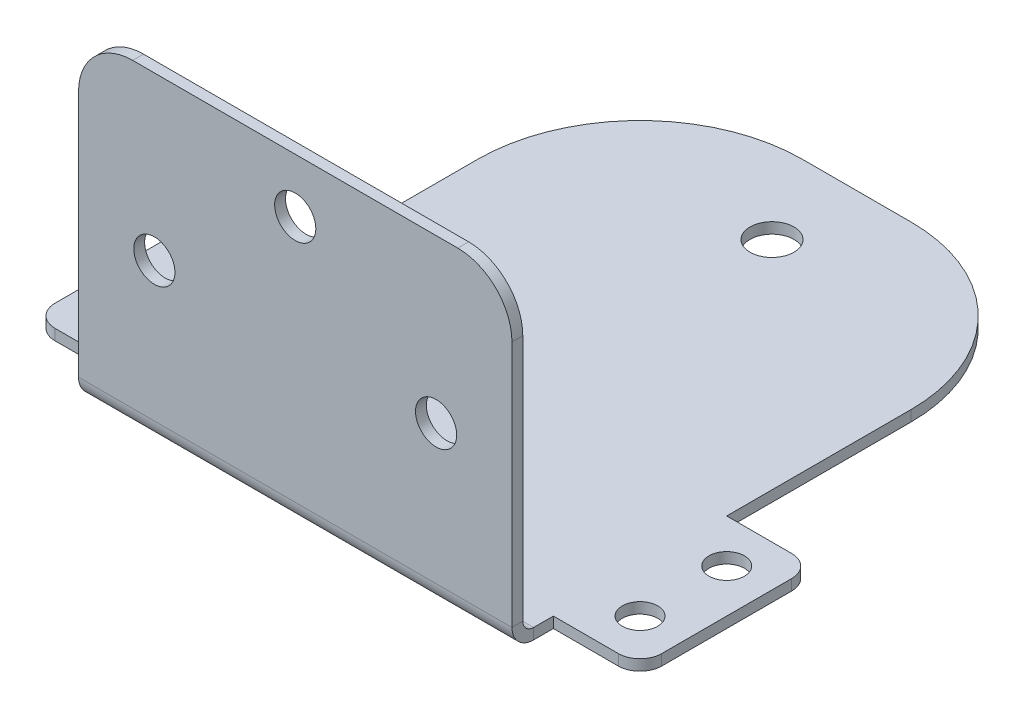
from build123d import *

# Parameters (mm, degrees)
BASE_FLANGE1_DEPTH       = 1
SKETCHED_START           = 11.616422755
SKETCHED_BEND1_OUTLINE_W = 40
SKETCHED_BEND1_OUTLINE_H = 1
SKETCHED_BEND1_DEPTH     = 28.383577245
SKETCHED_START_2         = 10.821902755
SKETCHED_BEND1_2_DEPTH   = 0.00548
SKETCHED_START_3         = 9.821902755
SKETCHED_BEND1_3_DEPTH   = 2
SKETCHED_START_4         = -20
SKETCHED_BEND1_4_DEPTH   = 40
SKETCH7_R                = 2.025
CUT_EXTRUDE1_DEPTH       = 10
F_6_CLEARANCE_HOLE1_D    = 3.7973
F_4_CLEARANCE_HOLE2_D    = 3.2639


with BuildPart() as part:
    # Base-Flange1: sheet metal written as solids
    # Sketch1 → Base-Flange1 (new body)
    with BuildSketch(Plane(origin=(0, 0, 0), x_dir=(1, 0, 0), z_dir=(0, 1, 0))):
        with BuildLine():
            Line((-20, -8), (-20, -35))
            ThreePointArc((-20, -35), (-18.535533906, -38.535533906), (-15, -40))
            Line((-15, -40), (15, -40))
            ThreePointArc((15, -40), (18.535533906, -38.535533906), (20, -35))
            Line((20, -35), (20, -8))
            Line((20, -8), (26, -8))
            ThreePointArc((26, -8), (27.414213562, -7.414213562), (28, -6))
            Line((28, -6), (28, 6))
            ThreePointArc((28, 6), (27.414213562, 7.414213562), (26, 8))
            Line((26, 8), (20, 8))
            Line((20, 8), (20, 25))
            ThreePointArc((20, 25), (15.606601718, 35.606601718), (5, 40))
            Line((5, 40), (-5, 40))
            ThreePointArc((-5, 40), (-15.606601718, 35.606601718), (-20, 25))
            Line((-20, 25), (-20, 8))
            Line((-20, 8), (-26, 8))
            ThreePointArc((-26, 8), (-27.414213562, 7.414213562), (-28, 6))
            Line((-28, 6), (-28, -6))
            ThreePointArc((-28, -6), (-27.414213562, -7.414213562), (-26, -8))
            Line((-26, -8), (-20, -8))
        make_face()
    extrude(amount=-BASE_FLANGE1_DEPTH)

    # Sketched Bend1: read off the stored shape, not the designer's step
    # Sketched Bend1 outline → Sketched Bend1 (cut)
    with BuildSketch(Plane.XY.offset(SKETCHED_START)):
        with Locations((0, -0.5)):
            Rectangle(SKETCHED_BEND1_OUTLINE_W, SKETCHED_BEND1_OUTLINE_H)
    extrude(amount=SKETCHED_BEND1_DEPTH, mode=Mode.SUBTRACT)

    # Sketched Bend1 2 outline → Sketched Bend1 2 (add)
    with BuildSketch(Plane.XY.offset(SKETCHED_START_2)):
        with BuildLine():
            Line((20, 0), (20, 23.821902755))
            ThreePointArc((20, 23.821902755), (18.535533906, 27.357436661), (15, 28.821902755))
            Line((15, 28.821902755), (-15, 28.821902755))
            ThreePointArc((-15, 28.821902755), (-18.535533906, 27.357436661), (-20, 23.821902755))
            Line((-20, 23.821902755), (-20, 0))
            Line((-20, 0), (20, 0))
        make_face()
    extrude(amount=SKETCHED_BEND1_2_DEPTH)

    # Sketched Bend1 3 outline → Sketched Bend1 3 (add)
    with BuildSketch(Plane.XY.offset(SKETCHED_START_3)):
        with BuildLine():
            Line((20, 0), (20, 23.821902755))
            ThreePointArc((20, 23.821902755), (18.535533906, 27.357436661), (15, 28.821902755))
            Line((15, 28.821902755), (-15, 28.821902755))
            ThreePointArc((-15, 28.821902755), (-18.535533906, 27.357436661), (-20, 23.821902755))
            Line((-20, 23.821902755), (-20, 0))
            Line((-20, 0), (20, 0))
        make_face()
    extrude(amount=SKETCHED_BEND1_3_DEPTH)

    # Sketched Bend1 4 outline → Sketched Bend1 4 (cut)
    with BuildSketch(Plane.YZ.offset(SKETCHED_START_4)):
        with BuildLine():
            Line((28.821902755, 9.821902755), (28.821902755, 10.821902755))
            Line((28.821902755, 10.821902755), (1, 10.821902755))
            ThreePointArc((1, 10.821902755), (0.292893219, 10.529009536), (0, 9.821902755))
            Line((0, 9.821902755), (28.821902755, 9.821902755))
        make_face()
        with BuildLine():
            ThreePointArc((-1, 9.821902755), (-0.414213562, 11.236116317), (1, 11.821902755))
            Line((1, 11.821902755), (0, 11.821902755))
            Line((0, 11.821902755), (0, 11.616422755))
            Line((0, 11.616422755), (-1, 11.616422755))
            Line((-1, 11.616422755), (-1, 9.821902755))
        make_face()
    extrude(amount=SKETCHED_BEND1_4_DEPTH, mode=Mode.SUBTRACT)

    # Sketch7 → Cut-Extrude1 (cut)
    with BuildSketch(Plane(origin=(0, 0, 0), x_dir=(1, 0, 0), z_dir=(0, 1, 0))):
        with Locations(Location((0, 32.178097245, 0), (0, 0, 270))):
            Circle(SKETCH7_R)
    extrude(amount=-CUT_EXTRUDE1_DEPTH, mode=Mode.SUBTRACT)

    # #6 Clearance Hole1 (through all)
    with Locations(Plane(origin=(0, 0, 10.821902755), x_dir=(-1, 0, 0), z_dir=(0, 0, -1))):
        with Locations((13, 13.821902755), (-13, 13.821902755), (0, 23.821902755)):
            Hole(F_6_CLEARANCE_HOLE1_D / 2)

    # #4 Clearance Hole2 (through all)
    with Locations(Plane(origin=(0, 0, 0), x_dir=(1, 0, 0), z_dir=(0, 1, 0))):
        with Locations((-24, 4), (-24, -4), (24, 4), (24, -4)):
            Hole(F_4_CLEARANCE_HOLE2_D / 2)


solid = part.part
